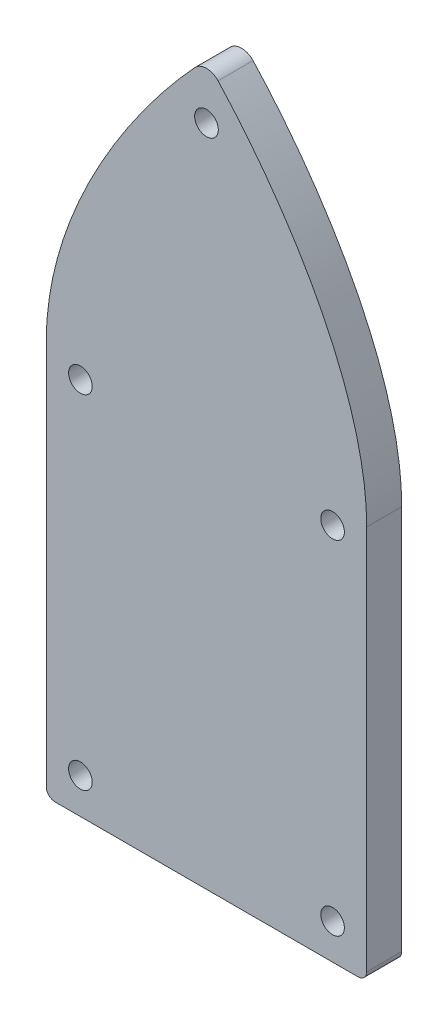
from build123d import *

# Parameters (mm, degrees)
BOSS_EXTRUDE1_DEPTH                     = 4
CBORE_FOR_M5_HEX_HEAD_BOLT1_D           = 2.7
CBORE_FOR_M5_HEX_HEAD_BOLT1_CBORE_D     = 5
CBORE_FOR_M5_HEX_HEAD_BOLT1_CBORE_DEPTH = 2
SKETCH6_R                               = 1.75
BOSS_EXTRUDE2_DEPTH                     = 4
FILLET1_R                               = 5.5
FILLET1_OF_MIRROR1_R                    = 5.5
FILLET2_R                               = 1.8
FILLET3_R                               = 1


with BuildPart() as part:
    # Sketch2 → Boss-Extrude1 (new body)
    with BuildSketch(Plane.XY):
        with BuildLine():
            Line((-18.3, -1.2), (18.3, -1.2))
            Line((18.3, -1.2), (18.3, 43.8))
            add(Edge.make_bspline(
                [(18.3, 43.8), (18.3, 58.8), (6.363961031, 74.436038969), (0, 80.8)],
                knots=[0, 0, 0, 0, 1, 1, 1, 1], degree=3))
            add(Edge.make_bspline(
                [(-18.3, 43.8), (-18.3, 58.8), (-6.363961031, 74.436038969), (0, 80.8)],
                knots=[0, 0, 0, 0, 1, 1, 1, 1], degree=3))
            Line((-18.3, 43.8), (-18.3, -1.2))
        make_face()
    extrude(amount=BOSS_EXTRUDE1_DEPTH)

    # CBORE for M5 Hex Head Bolt1 (through all)
    with Locations(Plane(origin=(0, 0, 0), x_dir=(-1, 0, 0), z_dir=(0, 0, -1))):
        with Locations((14.4, 42.017834424), (14.4, 2.863521172), (-14.4, 2.863521172), (-14.4, 42.017834424), (0, 74.6)):
            CounterBoreHole(CBORE_FOR_M5_HEX_HEAD_BOLT1_D / 2, CBORE_FOR_M5_HEX_HEAD_BOLT1_CBORE_D / 2, CBORE_FOR_M5_HEX_HEAD_BOLT1_CBORE_DEPTH)

    # Sketch6 → Boss-Extrude2 (add)
    with BuildSketch(Plane(origin=(7, 0, 0), x_dir=(0, 0, -1), z_dir=(1, 0, 0))):
        with BuildLine():
            Line((0, 44.8), (5.5, 44.8))
            ThreePointArc((5.5, 44.8), (10.5, 39.8), (5.5, 34.8))
            Line((5.5, 34.8), (0, 34.8))
            Line((0, 34.8), (0, 44.8))
        make_face()
        with Locations((5.5, 39.8)):
            Circle(SKETCH6_R, mode=Mode.SUBTRACT)
    boss_extrude2 = extrude(amount=-BOSS_EXTRUDE2_DEPTH)

    # Fillet1
    fillet1_edges = [part.edges().sort_by_distance(p)[0] for p in [
        (5, 34.8, 0),
        (5, 44.8, 0),
    ]]
    fillet(fillet1_edges, radius=FILLET1_R - 0.0001)  # a hair under: the kernel refuses the full size

    # Mirror1: Boss-Extrude2 across plane
    add(boss_extrude2.mirror(Plane(origin=(0, 0, 0), x_dir=(0, 0, 1), z_dir=(1, 0, 0))))

    # Fillet1 of Mirror1
    fillet1_of_mirror1_edges = [part.edges().sort_by_distance(p)[0] for p in [
        (-5, 34.8, 0),
        (-5, 44.8, 0),
    ]]
    fillet(fillet1_of_mirror1_edges, radius=FILLET1_OF_MIRROR1_R - 0.0001)  # a hair under: the kernel refuses the full size

    # Fillet2
    fillet2_edges = [part.edges().sort_by_distance(p)[0] for p in [
        (0, 80.8, 2),
    ]]
    fillet(fillet2_edges, radius=FILLET2_R)

    # Fillet3
    fillet3_edges = [part.edges().sort_by_distance(p)[0] for p in [
        (18.3, -1.2, 2),
        (-18.3, -1.2, 2),
    ]]
    fillet(fillet3_edges, radius=FILLET3_R)


solid = part.part
